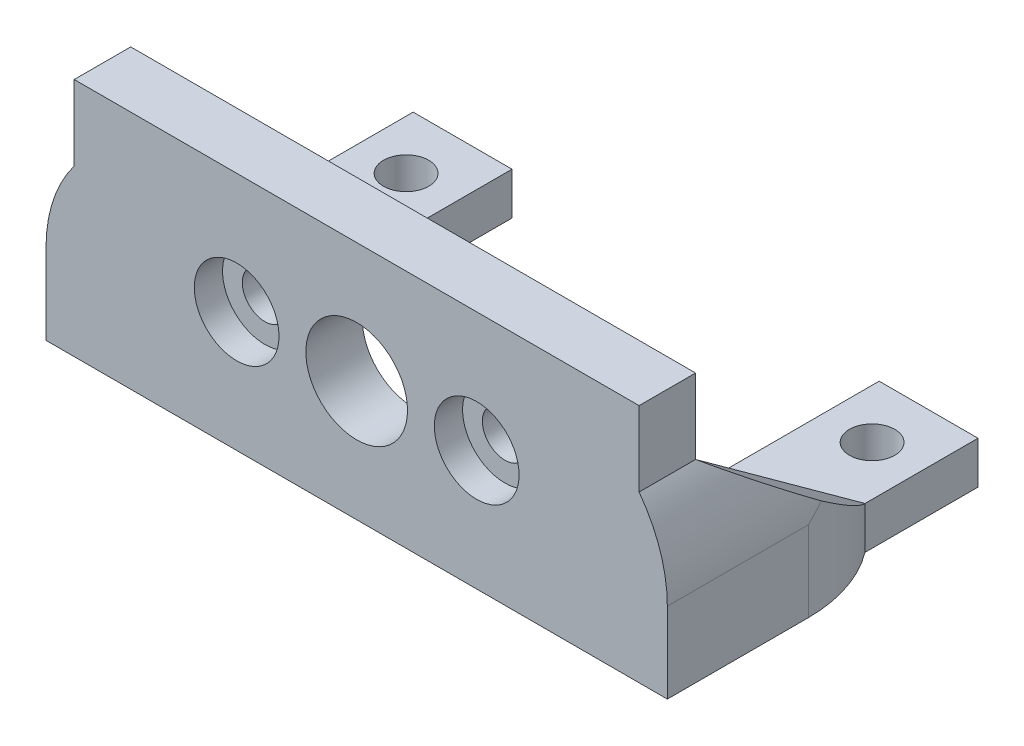
from build123d import *

# Parameters (mm, degrees)
SKETCH1_W            = 40
SKETCH1_H            = 17
SKETCH1_R            = 3.6
SKETCH1_R_2          = 1.6
BOSS_EXTRUDE1_DEPTH  = 4
SKETCH2_W            = 7
SKETCH2_H            = 3
BOSS_EXTRUDE2_DEPTH  = 20
SKETCH3_R            = 1.597664911
SKETCH3_R_2          = 1.6
CUT_EXTRUDE1_DEPTH   = 20
BOSS_EXTRUDE3_DEPTH  = 2
FILLET1_R            = 10
FILLET1_OF_MIRROR1_R = 10
SKETCH5_R            = 3
CUT_EXTRUDE2_DEPTH   = 2


with BuildPart() as part:
    # Sketch1 → Boss-Extrude1 (new body)
    with BuildSketch(Plane.XY):
        Rectangle(SKETCH1_W, SKETCH1_H)
        Circle(SKETCH1_R, mode=Mode.SUBTRACT)
        with Locations((8.5, 0)):
            Circle(SKETCH1_R_2, mode=Mode.SUBTRACT)
        with Locations(Location((-8.5, 0, 0), (0, 0, 180))):
            Circle(SKETCH1_R_2, mode=Mode.SUBTRACT)
    extrude(amount=BOSS_EXTRUDE1_DEPTH)

    # Sketch2 → Boss-Extrude2 (add)
    with BuildSketch(Plane(origin=(0, 0, 0), x_dir=(-1, 0, 0), z_dir=(0, 0, -1))):
        with Locations((16.5, -7)):
            Rectangle(SKETCH2_W, SKETCH2_H)
    boss_extrude2 = extrude(amount=BOSS_EXTRUDE2_DEPTH)

    # Sketch3 → Cut-Extrude1 (cut)
    with BuildSketch(Plane(origin=(0, -5.5, 0), x_dir=(1, 0, 0), z_dir=(0, 1, 0))):
        with Locations(Location((-16.5, 4, 0), (0, 0, 180))):
            Circle(SKETCH3_R)
        with Locations(Location((-16.5, 16, 0), (0, 0, 180))):
            Circle(SKETCH3_R_2)
    cut_extrude1 = extrude(amount=-CUT_EXTRUDE1_DEPTH, mode=Mode.SUBTRACT)

    # Sketch4 → Boss-Extrude3 (add)
    with BuildSketch(Plane.ZY.offset(20)):
        Polygon((0, 3.19845738), (-11.998610201, -5.5), (-11.998610201, -8.5), (4, -8.5), (4, 3.19845738), align=None)
    boss_extrude3 = extrude(amount=BOSS_EXTRUDE3_DEPTH)

    # Fillet1
    # the kernel refuses this fillet: 10 mm, written as the material it takes off along each edge
    with BuildSketch(Plane(origin=(-22, 9.5, -11.998610201), x_dir=(0, 0, 1), z_dir=(0, -1, 0))) as fillet1_piece_1:
        with BuildLine():
            CenterArc((6, -10), FILLET1_R, 90, 36.869897646)
            Line((0, -2), (-0.12, -1.84))
            ThreePointArc((-0.12, -1.84), (-0.2, -1), (-0.2, 0))
            Line((-0.2, 0), (0, 0.2))
            Line((0, 0.2), (6, 0.2))
            Line((6, 0.2), (6, 0))
        make_face()
    extrude(amount=33, mode=Mode.SUBTRACT)
    with BuildSketch(Plane(origin=(-22, 3.19845738, 19), x_dir=(1, 0, 0), z_dir=(0, 0, -1))) as fillet1_piece_2:
        with BuildLine():
            CenterArc((10, 6), FILLET1_R, 180, 36.869897646)
            Line((0, 6), (-0.2, 6))
            Line((-0.2, 6), (-0.2, 0))
            Line((-0.2, 0), (0, -0.2))
            ThreePointArc((0, -0.2), (1, -0.2), (1.84, -0.12))
            Line((1.84, -0.12), (2, 0))
        make_face()
    extrude(amount=34, mode=Mode.SUBTRACT)

    # Mirror1: Boss-Extrude2, Cut-Extrude1, Boss-Extrude3 across plane
    add(boss_extrude2.mirror(Plane(origin=(0, 0, 0), x_dir=(0, 0, 1), z_dir=(1, 0, 0))))
    add(cut_extrude1.mirror(Plane(origin=(0, 0, 0), x_dir=(0, 0, 1), z_dir=(1, 0, 0))), mode=Mode.SUBTRACT)
    add(boss_extrude3.mirror(Plane(origin=(0, 0, 0), x_dir=(0, 0, 1), z_dir=(1, 0, 0))))

    # Fillet1 of Mirror1
    # the kernel refuses this fillet: 10 mm, written as the material it takes off along each edge
    with BuildSketch(Plane(origin=(22, 9.5, -11.998610201), x_dir=(-1, 0, 0), z_dir=(0, -1, 0))) as fillet1_of_mirror1_piece_1:
        with BuildLine():
            CenterArc((10, -6), FILLET1_OF_MIRROR1_R, 143.130102354, 36.869897646)
            Line((0, -6), (-0.2, -6))
            Line((-0.2, -6), (-0.2, 0))
            Line((-0.2, 0), (0, 0.2))
            ThreePointArc((0, 0.2), (1, 0.2), (1.84, 0.12))
            Line((1.84, 0.12), (2, 0))
        make_face()
    extrude(amount=33, mode=Mode.SUBTRACT)
    with BuildSketch(Plane(origin=(22, 3.19845738, 19), x_dir=(-1, 0, 0), z_dir=(0, 0, -1))) as fillet1_of_mirror1_piece_2:
        with BuildLine():
            CenterArc((10, -6), FILLET1_OF_MIRROR1_R, 143.130102354, 36.869897646)
            Line((0, -6), (-0.2, -6))
            Line((-0.2, -6), (-0.2, 0))
            Line((-0.2, 0), (0, 0.2))
            ThreePointArc((0, 0.2), (1, 0.2), (1.84, 0.12))
            Line((1.84, 0.12), (2, 0))
        make_face()
    extrude(amount=34, mode=Mode.SUBTRACT)

    # Sketch5 → Cut-Extrude2 (cut)
    with BuildSketch(Plane.XY.offset(4)):
        with Locations((-8.5, 0)):
            Circle(SKETCH5_R)
        with Locations((8.5, 0)):
            Circle(SKETCH5_R)
    extrude(amount=-CUT_EXTRUDE2_DEPTH, mode=Mode.SUBTRACT)


solid = part.part
